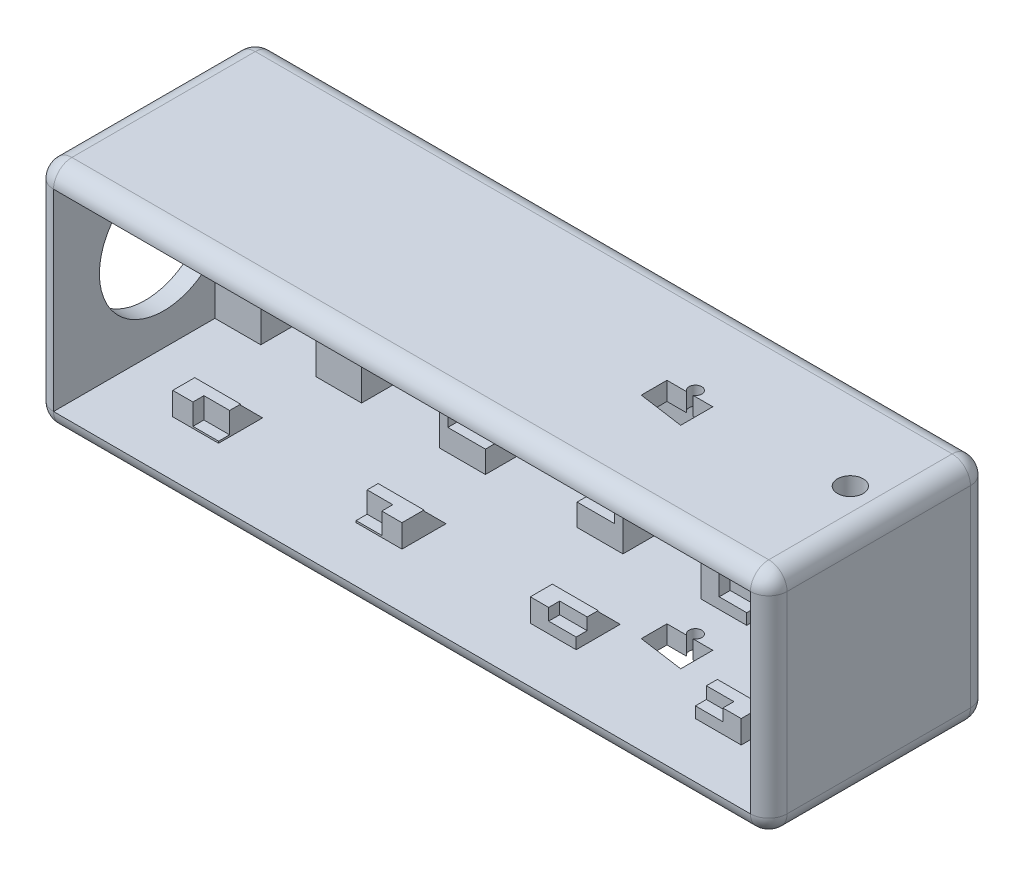
from build123d import *

# Parameters (mm, degrees)
SKETCH1_W                   = 125
SKETCH1_H                   = 400
BOSS_EXTRUDE1_DEPTH         = 60
SHELL2_T                    = -10
BOSS_EXTRUDE2_REACH         = 240.38
SKETCH3_W                   = 25
SKETCH3_H                   = 12
CENTER_START                = -12
SKETCH10_W                  = 310
SKETCH10_H                  = 80
CENTER_TOP_EXTRUDE_DEPTH    = 12
DIRKS_PCB_W                 = 95
DIRKS_PCB_H                 = 93
DIRKS_EXTRUED_DEPTH         = 6
ADRIAN_PCB_W                = 103
ADRIAN_PCB_H                = 103
ADRIAN_EXTRUDE_DEPTH        = 6
CENTER_BOTTOM_SKETCH_W      = 257.5
CENTER_BOTTOM_SKETCH_H      = 70
CENTER_BOTTOM_EXTRUDE_DEPTH = 12
ANDREW_PCB_W                = 90
ANDREW_PCB_H                = 93
ANDREW_EXTRUDE_DEPTH        = 6
SAM_PCB_W                   = 91
SAM_PCB_H                   = 81
SAM_EXTRUDE_DEPTH           = 6
FILLET1_R                   = 10
GLASS_DOME_SKETCH_R         = 35
DOME_CUT_SLOT_DEPTH         = 10
MO_PCB_W                    = 64
MO_PCB_H                    = 60
CUT_EXTRUDE2_DEPTH          = 6
CHAMFER1_SIZE               = 12
CUT_EXTRUDE3_DEPTH          = 244.361870473
CUT_EXTRUDE3_DEPTH_BACK     = 244.361870473
CUT_EXTRUDE4_DEPTH          = 244.361870473
CUT_EXTRUDE4_DEPTH_BACK     = 10
SKETCH11_R                  = 7


# Some blends are built 0.0001 mm under size
with BuildPart() as part:
    # Sketch1 → Boss-Extrude1 (new, symmetric)
    with BuildSketch(Plane(origin=(0, 0, 0), x_dir=(0, 1, 0), z_dir=(0, 0, 1))):
        Rectangle(SKETCH1_W, SKETCH1_H)
    extrude(amount=BOSS_EXTRUDE1_DEPTH, both=True)

    # Shell2
    shell2_openings = [part.faces().sort_by_distance(p)[0] for p in [
        (0, 0, 60),
    ]]
    offset(amount=SHELL2_T, openings=shell2_openings, kind=Kind.INTERSECTION)

    # Sketch3 → Boss-Extrude2 (add, up to next)
    with BuildSketch(Plane.XZ.offset(-52.5), mode=Mode.PRIVATE) as boss_extrude2_sk1:
        with Locations((-142.5, 24)):
            Rectangle(SKETCH3_W, SKETCH3_H)
    boss_extrude2_tool1 = extrude(boss_extrude2_sk1.sketch, amount=BOSS_EXTRUDE2_REACH, mode=Mode.PRIVATE) - part.part
    # Sketch3 → Boss-Extrude2 (add, up to next)
    with BuildSketch(Plane.XZ.offset(-52.5), mode=Mode.PRIVATE) as boss_extrude2_sk2:
        with Locations((-42.5, 24)):
            Rectangle(SKETCH3_W, SKETCH3_H)
    boss_extrude2_tool2 = extrude(boss_extrude2_sk2.sketch, amount=BOSS_EXTRUDE2_REACH, mode=Mode.PRIVATE) - part.part
    # Sketch3 → Boss-Extrude2 (add, up to next)
    with BuildSketch(Plane.XZ.offset(-52.5), mode=Mode.PRIVATE) as boss_extrude2_sk3:
        with Locations((-177.5, -34)):
            Rectangle(SKETCH3_W, SKETCH3_H)
    boss_extrude2_tool3 = extrude(boss_extrude2_sk3.sketch, amount=BOSS_EXTRUDE2_REACH, mode=Mode.PRIVATE) - part.part
    # Sketch3 → Boss-Extrude2 (add, up to next)
    with BuildSketch(Plane.XZ.offset(-52.5), mode=Mode.PRIVATE) as boss_extrude2_sk4:
        with Locations((-122.5, -34)):
            Rectangle(SKETCH3_W, SKETCH3_H)
    boss_extrude2_tool4 = extrude(boss_extrude2_sk4.sketch, amount=BOSS_EXTRUDE2_REACH, mode=Mode.PRIVATE) - part.part
    # Sketch3 → Boss-Extrude2 (add, up to next)
    with BuildSketch(Plane.XZ.offset(-52.5), mode=Mode.PRIVATE) as boss_extrude2_sk5:
        with Locations((52.5, 24)):
            Rectangle(SKETCH3_W, SKETCH3_H)
    boss_extrude2_tool5 = extrude(boss_extrude2_sk5.sketch, amount=BOSS_EXTRUDE2_REACH, mode=Mode.PRIVATE) - part.part
    # Sketch3 → Boss-Extrude2 (add, up to next)
    with BuildSketch(Plane.XZ.offset(-52.5), mode=Mode.PRIVATE) as boss_extrude2_sk6:
        with Locations((142.5, 24)):
            Rectangle(SKETCH3_W, SKETCH3_H)
    boss_extrude2_tool6 = extrude(boss_extrude2_sk6.sketch, amount=BOSS_EXTRUDE2_REACH, mode=Mode.PRIVATE) - part.part
    # Sketch3 → Boss-Extrude2 (add, up to next)
    with BuildSketch(Plane.XZ.offset(-52.5), mode=Mode.PRIVATE) as boss_extrude2_sk7:
        with Locations((87.5, -34)):
            Rectangle(SKETCH3_W, SKETCH3_H)
    boss_extrude2_tool7 = extrude(boss_extrude2_sk7.sketch, amount=BOSS_EXTRUDE2_REACH, mode=Mode.PRIVATE) - part.part
    # Sketch3 → Boss-Extrude2 (add, up to next)
    with BuildSketch(Plane.XZ.offset(-52.5), mode=Mode.PRIVATE) as boss_extrude2_sk8:
        with Locations((177.5, -34)):
            Rectangle(SKETCH3_W, SKETCH3_H)
    boss_extrude2_tool8 = extrude(boss_extrude2_sk8.sketch, amount=BOSS_EXTRUDE2_REACH, mode=Mode.PRIVATE) - part.part
    # Sketch3 → Boss-Extrude2 (add, up to next)
    with BuildSketch(Plane.XZ.offset(-52.5), mode=Mode.PRIVATE) as boss_extrude2_sk9:
        with Locations((20, -34)):
            Rectangle(SKETCH3_W, SKETCH3_H)
    boss_extrude2_tool9 = extrude(boss_extrude2_sk9.sketch, amount=BOSS_EXTRUDE2_REACH, mode=Mode.PRIVATE) - part.part
    # Sketch3 → Boss-Extrude2 (add, up to next)
    with BuildSketch(Plane.XZ.offset(-52.5), mode=Mode.PRIVATE) as boss_extrude2_sk10:
        with Locations((-55, -34)):
            Rectangle(SKETCH3_W, SKETCH3_H)
    boss_extrude2_tool10 = extrude(boss_extrude2_sk10.sketch, amount=BOSS_EXTRUDE2_REACH, mode=Mode.PRIVATE) - part.part
    add(boss_extrude2_tool1.solids().sort_by_distance((-142.5, 52.5, 24))[0])
    add(boss_extrude2_tool2.solids().sort_by_distance((-42.5, 52.5, 24))[0])
    add(boss_extrude2_tool3.solids().sort_by_distance((-177.5, 52.5, -34))[0])
    add(boss_extrude2_tool4.solids().sort_by_distance((-122.5, 52.5, -34))[0])
    add(boss_extrude2_tool5.solids().sort_by_distance((52.5, 52.5, 24))[0])
    add(boss_extrude2_tool6.solids().sort_by_distance((142.5, 52.5, 24))[0])
    add(boss_extrude2_tool7.solids().sort_by_distance((87.5, 52.5, -34))[0])
    add(boss_extrude2_tool8.solids().sort_by_distance((177.5, 52.5, -34))[0])
    add(boss_extrude2_tool9.solids().sort_by_distance((20, 52.5, -34))[0])
    add(boss_extrude2_tool10.solids().sort_by_distance((-55, 52.5, -34))[0])

    # Sketch10 → Center Top Extrude (cut)
    with BuildSketch(Plane.XY.offset(30).offset(CENTER_START)):
        Rectangle(SKETCH10_W, SKETCH10_H)
    extrude(amount=CENTER_TOP_EXTRUDE_DEPTH, mode=Mode.SUBTRACT)

    # Dirks PCB → Dirks Extrued (cut)
    with BuildSketch(Plane.XY.offset(30)):
        with Locations((97.5, 0)):
            Rectangle(DIRKS_PCB_W, DIRKS_PCB_H)
    extrude(amount=-DIRKS_EXTRUED_DEPTH, mode=Mode.SUBTRACT)

    # Adrian PCB → Adrian Extrude (cut)
    with BuildSketch(Plane.XY.offset(30)):
        with Locations((-92.5, 0)):
            Rectangle(ADRIAN_PCB_W, ADRIAN_PCB_H)
    extrude(amount=-ADRIAN_EXTRUDE_DEPTH, mode=Mode.SUBTRACT)

    # Center Bottom Sketch → Center Bottom Extrude (cut)
    with BuildSketch(Plane.XY.offset(-28).offset(CENTER_START)):
        with Locations((61.25, 0)):
            Rectangle(CENTER_BOTTOM_SKETCH_W, CENTER_BOTTOM_SKETCH_H)
    extrude(amount=CENTER_BOTTOM_EXTRUDE_DEPTH, mode=Mode.SUBTRACT)

    # Andrew PCB → Andrew Extrude (cut)
    with BuildSketch(Plane.XY.offset(-28)):
        with Locations((130, 0)):
            Rectangle(ANDREW_PCB_W, ANDREW_PCB_H)
    extrude(amount=-ANDREW_EXTRUDE_DEPTH, mode=Mode.SUBTRACT)

    # Sam PCB → Sam Extrude (cut)
    with BuildSketch(Plane.XY.offset(-28)):
        with Locations((-17.5, 0)):
            Rectangle(SAM_PCB_W, SAM_PCB_H)
    extrude(amount=-SAM_EXTRUDE_DEPTH, mode=Mode.SUBTRACT)

    # Fillet1
    fillet1_edges = [part.edges().sort_by_distance(p)[0] for p in [
        (0, 62.5, 60),
        (0, 62.5, -60),
        (200, 0, 60),
        (200, 62.5, 0),
        (200, 0, -60),
        (0, -62.5, 60),
        (200, -62.5, 0),
        (0, -62.5, -60),
        (-200, 62.5, 0),
        (-200, 0, 60),
        (-200, -62.5, 0),
        (-200, 0, -60),
        (-42.5, 46.5, -28),
    ]]
    fillet(fillet1_edges, radius=FILLET1_R - 0.0001)  # a hair under: the kernel refuses the full size

    # Glass Dome Sketch → Dome Cut/Slot (cut)
    with BuildSketch(Plane(origin=(-200, 0, 0), x_dir=(0, -1, 0), z_dir=(-1, 0, 0))):
        with Locations(Location((0, 0, 0), (0, 0, 90))):
            Circle(GLASS_DOME_SKETCH_R)
    extrude(amount=-DOME_CUT_SLOT_DEPTH, mode=Mode.SUBTRACT)

    # Mo Pcb → Cut-Extrude2 (cut)
    with BuildSketch(Plane.XY.offset(-28)):
        with Locations((-149.136268657, -0.682399663)):
            Rectangle(MO_PCB_W, MO_PCB_H)
    extrude(amount=-CUT_EXTRUDE2_DEPTH, mode=Mode.SUBTRACT)

    # Chamfer1
    # the kernel refuses this chamfer: 12 mm, written as the material it adds along each edge
    with BuildSketch(Plane(origin=(-110, 52.5, -40), x_dir=(-1.1402543659205693e-15, 0.027495876610587357, -0.9996219169112968), z_dir=(-1, 0, 0)), Plane(origin=(-135, -52.5, -40), x_dir=(-1.1364385465086533e-15, -0.027495876610586206, -0.9996219169112968), z_dir=(1, 0, 0)), Plane(origin=(155, 52.5, 18), x_dir=(0, 0.027495876610584474, -0.9996219169112969), z_dir=(-1, 0, 0)), Plane(origin=(-30, 52.5, 18), x_dir=(0, 0.027495876610586778, -0.9996219169112968), z_dir=(-1, 0, 0)), Plane(origin=(-55, -52.5, 18), x_dir=(0, -0.027495876610586202, -0.9996219169112968), z_dir=(1, 0, 0)), Plane(origin=(130, -52.5, 18), x_dir=(0, -0.027495876610586202, -0.9996219169112968), z_dir=(1, 0, 0))) as chamfer1_piece_1:
        Polygon((CHAMFER1_SIZE * 0.999621916911, CHAMFER1_SIZE * 0.0274958766106), (-CHAMFER1_SIZE * 0.0274958766106, CHAMFER1_SIZE * 0.999621916911), (0, 0), align=None)
    extrude(amount=25)
    with BuildSketch(Plane(origin=(-110, 52.5, -40), x_dir=(-1.1402543659205693e-15, 0.027495876610587357, -0.9996219169112968), z_dir=(-1, 0, 0))) as chamfer1_piece_2_section:
        Polygon((CHAMFER1_SIZE * 0.999621916911, CHAMFER1_SIZE * 0.0274958766106), (-CHAMFER1_SIZE * 0.0274958766106, CHAMFER1_SIZE * 0.999621916911), (0, 0), align=None)
    chamfer1_piece_2 = extrude(amount=55.860195856, mode=Mode.PRIVATE)
    chamfer1_piece_2 = split(chamfer1_piece_2, bisect_by=Plane(origin=(-165, 48.542476478, -43.957523522), z_dir=(-1, 0, 0)), keep=Keep.TOP, mode=Mode.PRIVATE)
    add(chamfer1_piece_2)
    with BuildSketch(Plane(origin=(-190, 52.5, -40), x_dir=(1.1326227270967374e-15, 0.02749587661058851, -0.9996219169112968), z_dir=(1, 0, 0)), Plane(origin=(-165, -52.5, -40), x_dir=(1.1364385465086533e-15, -0.027495876610586206, -0.9996219169112968), z_dir=(-1, 0, 0)), Plane(origin=(40, 52.5, 18), x_dir=(0, 0.027495876610585626, -0.9996219169112968), z_dir=(1, 0, 0)), Plane(origin=(-155, 52.5, 18), x_dir=(0, 0.02749587661058793, -0.9996219169112968), z_dir=(1, 0, 0)), Plane(origin=(-130, -52.5, 18), x_dir=(0, -0.027495876610586202, -0.9996219169112968), z_dir=(-1, 0, 0)), Plane(origin=(65, -52.5, 18), x_dir=(0, -0.027495876610586202, -0.9996219169112968), z_dir=(-1, 0, 0))) as chamfer1_piece_3:
        Polygon((CHAMFER1_SIZE * 0.999621916911, -CHAMFER1_SIZE * 0.0274958766106), (-CHAMFER1_SIZE * 0.0274958766106, -CHAMFER1_SIZE * 0.999621916911), (0, 0), align=None)
    extrude(amount=25)
    with BuildSketch(Plane(origin=(-190, 52.5, -40), x_dir=(1.1326227270967374e-15, 0.02749587661058851, -0.9996219169112968), z_dir=(1, 0, 0))) as chamfer1_piece_4_section:
        Polygon((CHAMFER1_SIZE * 0.999621916911, -CHAMFER1_SIZE * 0.0274958766106), (-CHAMFER1_SIZE * 0.0274958766106, -CHAMFER1_SIZE * 0.999621916911), (0, 0), align=None)
    chamfer1_piece_4 = extrude(amount=55.860195856, mode=Mode.PRIVATE)
    chamfer1_piece_4 = split(chamfer1_piece_4, bisect_by=Plane(origin=(-135, 48.542476478, -43.957523522), z_dir=(1, 0, 0)), keep=Keep.TOP, mode=Mode.PRIVATE)
    add(chamfer1_piece_4)
    with BuildSketch(Plane(origin=(-165.860195856, -52.5, -40), x_dir=(-1.1364385465086533e-15, -0.027495876610586206, -0.9996219169112968), z_dir=(1, 0, 0))) as chamfer1_piece_5_section:
        Polygon((CHAMFER1_SIZE * 0.999621916911, CHAMFER1_SIZE * 0.0274958766106), (-CHAMFER1_SIZE * 0.0274958766106, CHAMFER1_SIZE * 0.999621916911), (0, 0), align=None)
    chamfer1_piece_5 = extrude(amount=55.860195856, mode=Mode.PRIVATE)
    chamfer1_piece_5 = split(chamfer1_piece_5, bisect_by=Plane(origin=(-165, -48.542476478, -43.957523522), z_dir=(-1, 0, 0)), keep=Keep.TOP, mode=Mode.PRIVATE)
    add(chamfer1_piece_5)
    with BuildSketch(Plane(origin=(-134.139804144, -52.5, -40), x_dir=(1.1364385465086533e-15, -0.027495876610586206, -0.9996219169112968), z_dir=(-1, 0, 0))) as chamfer1_piece_6_section:
        Polygon((CHAMFER1_SIZE * 0.999621916911, -CHAMFER1_SIZE * 0.0274958766106), (-CHAMFER1_SIZE * 0.0274958766106, -CHAMFER1_SIZE * 0.999621916911), (0, 0), align=None)
    chamfer1_piece_6 = extrude(amount=55.860195856, mode=Mode.PRIVATE)
    chamfer1_piece_6 = split(chamfer1_piece_6, bisect_by=Plane(origin=(-135, -48.542476478, -43.957523522), z_dir=(1, 0, 0)), keep=Keep.TOP, mode=Mode.PRIVATE)
    add(chamfer1_piece_6)

    # Chamfer2
    # the kernel refuses this chamfer: 18 mm, written as the material it adds along each edge
    with BuildSketch(Plane(origin=(7.5, 52.5, -40), x_dir=(0, 0.02749587661058639, -0.9996219169112966), z_dir=(1, 0, 0))) as chamfer2_piece_1_section:
        with BuildLine():
            Line((18.516117513, 0), (-1.017848788, -18.488120283))
            Line((-1.017848788, -18.488120283), (-1.377712678, -18.478221768))
            ThreePointArc((-1.377712678, -18.478221768), (-0.614326087, -9.241160934), (-0.35986389, 0.009898516))
            Line((-0.35986389, 0.009898516), (0.009898516, 0.35986389))
            ThreePointArc((0.009898516, 0.35986389), (9.260957965, 0.105401693), (18.526016029, 0.35986389))
            Line((18.526016029, 0.35986389), (18.516117513, 0))
        make_face()
    chamfer2_piece_1 = extrude(amount=25, mode=Mode.PRIVATE)
    chamfer2_piece_1 = split(chamfer2_piece_1, bisect_by=Plane(origin=(20, 35, -45.965811058), z_dir=(0, 1, 0)), keep=Keep.TOP, mode=Mode.PRIVATE)
    add(chamfer2_piece_1)
    with BuildSketch(Plane(origin=(100, -52.5, -40), x_dir=(0, -0.02749587661058639, -0.9996219169112966), z_dir=(-1, 0, 0))) as chamfer2_piece_2_section:
        with BuildLine():
            Line((18.516117513, 0), (-1.017848788, -18.488120283))
            Line((-1.017848788, -18.488120283), (-1.377712678, -18.478221768))
            ThreePointArc((-1.377712678, -18.478221768), (-0.614326087, -9.241160934), (-0.35986389, 0.009898516))
            Line((-0.35986389, 0.009898516), (0.009898516, 0.35986389))
            ThreePointArc((0.009898516, 0.35986389), (9.260957965, 0.105401693), (18.526016029, 0.35986389))
            Line((18.526016029, 0.35986389), (18.516117513, 0))
        make_face()
    chamfer2_piece_2 = extrude(amount=25, mode=Mode.PRIVATE)
    chamfer2_piece_2 = split(chamfer2_piece_2, bisect_by=Plane(origin=(87.5, -35, -45.965811058), z_dir=(0, -1, 0)), keep=Keep.TOP, mode=Mode.PRIVATE)
    add(chamfer2_piece_2)
    with BuildSketch(Plane(origin=(75, 52.5, -40), x_dir=(0, 0.027495876610586008, -0.9996219169112966), z_dir=(1, 0, 0))) as chamfer2_piece_3_section:
        with BuildLine():
            Line((18.516117513, 0), (-1.017848788, -18.488120283))
            Line((-1.017848788, -18.488120283), (-1.377712678, -18.478221768))
            ThreePointArc((-1.377712678, -18.478221768), (-0.614326087, -9.241160934), (-0.35986389, 0.009898516))
            Line((-0.35986389, 0.009898516), (0.009898516, 0.35986389))
            ThreePointArc((0.009898516, 0.35986389), (9.260957965, 0.105401693), (18.526016029, 0.35986389))
            Line((18.526016029, 0.35986389), (18.516117513, 0))
        make_face()
    chamfer2_piece_3 = extrude(amount=25, mode=Mode.PRIVATE)
    chamfer2_piece_3 = split(chamfer2_piece_3, bisect_by=Plane(origin=(87.5, 35, -45.965811058), z_dir=(0, 1, 0)), keep=Keep.TOP, mode=Mode.PRIVATE)
    add(chamfer2_piece_3)
    with BuildSketch(Plane(origin=(190, 52.5, -40), x_dir=(0, 0.02749587661058486, -0.9996219169112969), z_dir=(-1, 0, 0))) as chamfer2_piece_4_section:
        with BuildLine():
            Line((18.516117513, 0), (-1.017848788, 18.488120283))
            Line((-1.017848788, 18.488120283), (-1.377712678, 18.478221768))
            ThreePointArc((-1.377712678, 18.478221768), (-0.614326087, 9.241160934), (-0.35986389, -0.009898516))
            Line((-0.35986389, -0.009898516), (0.009898516, -0.35986389))
            ThreePointArc((0.009898516, -0.35986389), (9.260957965, -0.105401693), (18.526016029, -0.35986389))
            Line((18.526016029, -0.35986389), (18.516117513, 0))
        make_face()
    chamfer2_piece_4 = extrude(amount=25, mode=Mode.PRIVATE)
    chamfer2_piece_4 = split(chamfer2_piece_4, bisect_by=Plane(origin=(177.5, 35, -45.965811058), z_dir=(0, 1, 0)), keep=Keep.TOP, mode=Mode.PRIVATE)
    add(chamfer2_piece_4)
    with BuildSketch(Plane(origin=(165, -52.5, -40), x_dir=(0, 0.9996219169112966, 0.02749587661058639), z_dir=(1, 0, 0))) as chamfer2_piece_5_section:
        with BuildLine():
            Line((18.516117513, 0), (-1.017848788, -18.488120283))
            Line((-1.017848788, -18.488120283), (-1.377712678, -18.478221768))
            ThreePointArc((-1.377712678, -18.478221768), (-0.614326087, -9.241160934), (-0.35986389, 0.009898516))
            Line((-0.35986389, 0.009898516), (0.009898516, 0.35986389))
            ThreePointArc((0.009898516, 0.35986389), (9.260957965, 0.105401693), (18.526016029, 0.35986389))
            Line((18.526016029, 0.35986389), (18.516117513, 0))
        make_face()
    chamfer2_piece_5 = extrude(amount=25, mode=Mode.PRIVATE)
    chamfer2_piece_5 = split(chamfer2_piece_5, bisect_by=Plane(origin=(177.5, -35, -45.965811058), z_dir=(0, -1, 0)), keep=Keep.TOP, mode=Mode.PRIVATE)
    add(chamfer2_piece_5)
    with BuildSketch(Plane(origin=(-67.5, -52.5, -40), x_dir=(0, -0.02749587661058639, -0.9996219169112966), z_dir=(1, 0, 0))) as chamfer2_piece_6_section:
        with BuildLine():
            Line((18.516117513, 0), (-1.017848788, 18.488120283))
            Line((-1.017848788, 18.488120283), (-1.377712678, 18.478221768))
            ThreePointArc((-1.377712678, 18.478221768), (-0.614326087, 9.241160934), (-0.35986389, -0.009898516))
            Line((-0.35986389, -0.009898516), (0.009898516, -0.35986389))
            ThreePointArc((0.009898516, -0.35986389), (9.260957965, -0.105401693), (18.526016029, -0.35986389))
            Line((18.526016029, -0.35986389), (18.516117513, 0))
        make_face()
    chamfer2_piece_6 = extrude(amount=25, mode=Mode.PRIVATE)
    chamfer2_piece_6 = split(chamfer2_piece_6, bisect_by=Plane(origin=(-55, -35, -45.965811058), z_dir=(0, -1, 0)), keep=Keep.TOP, mode=Mode.PRIVATE)
    add(chamfer2_piece_6)
    with BuildSketch(Plane(origin=(-42.5, 52.5, -40), x_dir=(0, 0.027495876610586775, -0.9996219169112966), z_dir=(-1, 0, 0))) as chamfer2_piece_7_section:
        with BuildLine():
            Line((18.516117513, 0), (-1.017848788, 18.488120283))
            Line((-1.017848788, 18.488120283), (-1.377712678, 18.478221768))
            ThreePointArc((-1.377712678, 18.478221768), (-0.614326087, 9.241160934), (-0.35986389, -0.009898516))
            Line((-0.35986389, -0.009898516), (0.009898516, -0.35986389))
            ThreePointArc((0.009898516, -0.35986389), (9.260957965, -0.105401693), (18.526016029, -0.35986389))
            Line((18.526016029, -0.35986389), (18.516117513, 0))
        make_face()
    chamfer2_piece_7 = extrude(amount=25, mode=Mode.PRIVATE)
    chamfer2_piece_7 = split(chamfer2_piece_7, bisect_by=Plane(origin=(-55, 35, -45.965811058), z_dir=(0, 1, 0)), keep=Keep.TOP, mode=Mode.PRIVATE)
    add(chamfer2_piece_7)
    with BuildSketch(Plane(origin=(32.5, -52.5, -40), x_dir=(0, -0.02749587661058639, -0.9996219169112966), z_dir=(-1, 0, 0))) as chamfer2_piece_8_section:
        with BuildLine():
            Line((18.516117513, 0), (-1.017848788, -18.488120283))
            Line((-1.017848788, -18.488120283), (-1.377712678, -18.478221768))
            ThreePointArc((-1.377712678, -18.478221768), (-0.614326087, -9.241160934), (-0.35986389, 0.009898516))
            Line((-0.35986389, 0.009898516), (0.009898516, 0.35986389))
            ThreePointArc((0.009898516, 0.35986389), (9.260957965, 0.105401693), (18.526016029, 0.35986389))
            Line((18.526016029, 0.35986389), (18.516117513, 0))
        make_face()
    chamfer2_piece_8 = extrude(amount=25, mode=Mode.PRIVATE)
    chamfer2_piece_8 = split(chamfer2_piece_8, bisect_by=Plane(origin=(20, -35, -45.965811058), z_dir=(0, -1, 0)), keep=Keep.TOP, mode=Mode.PRIVATE)
    add(chamfer2_piece_8)

    # Motor Cutout → Cut-Extrude3 (cut, two sides: drawn at the far end of the back side and taken through both)
    with BuildSketch(Plane.XZ.offset(62.5).offset(-CUT_EXTRUDE3_DEPTH_BACK)):
        Polygon((102.5, 10.513520868), (102.5, 7), (77.5, 7), align=None)
        with BuildLine():
            Line((77.5, -7), (88.197224362, -7))
            ThreePointArc((88.197224362, -7), (90, -13.5), (91.802775638, -7))
            Line((91.802775638, -7), (102.5, -7))
            Line((102.5, -7), (102.5, 7))
            Line((102.5, 7), (77.5, 7))
            Line((77.5, 7), (77.5, -7))
        make_face()
    extrude(amount=CUT_EXTRUDE3_DEPTH + CUT_EXTRUDE3_DEPTH_BACK, mode=Mode.SUBTRACT)

    # Sketch11 → Cut-Extrude4 (cut, two sides: drawn at the far end of the back side and taken through both)
    with BuildSketch(Plane(origin=(0, 62.5, 0), x_dir=(1, 0, 0), z_dir=(0, 1, 0)).offset(-CUT_EXTRUDE4_DEPTH_BACK)):
        with Locations(Location((177.5, 7, 0), (0, 0, 90))):
            Circle(SKETCH11_R)
    extrude(amount=CUT_EXTRUDE4_DEPTH + CUT_EXTRUDE4_DEPTH_BACK, mode=Mode.SUBTRACT)


solid = part.part
